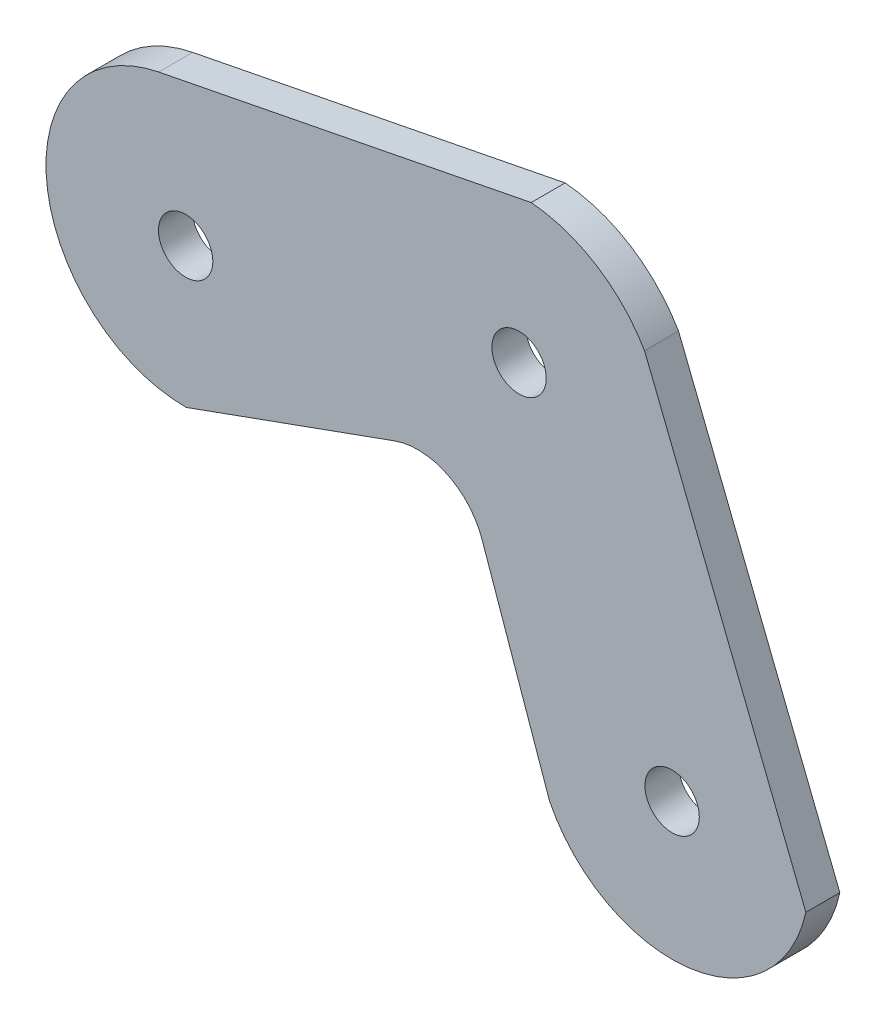
from build123d import *

# Parameters (mm, degrees)
SKETCH_1_R      = 4
EXTRUDE_1_DEPTH = 5


with BuildPart() as part:
    # 草图1 → 凸台-拉伸1 (new body)
    with BuildSketch(Plane.XY):
        with BuildLine():
            Line((36.178446258, 44.450768961), (66.852758603, 55.522112342))
            ThreePointArc((66.852758603, 55.522112342), (74.542251323, 55.146923882), (79.686411635, 49.419212353))
            Line((79.686411635, 49.419212353), (89.614398352, 21.050380059))
            ThreePointArc((89.614398352, 21.050380059), (110.127424639, 10.005834432), (127.344312529, 25.70121614))
            Line((127.344312529, 25.70121614), (103.609378398, 85.394704235))
            ThreePointArc((103.609378398, 85.394704235), (96.558072376, 92.705940943), (86.927534136, 95.93515633))
            Line((86.927534136, 95.93515633), (32.120142981, 85.163730465))
            ThreePointArc((32.120142981, 85.163730465), (15.634853586, 62.961714189), (36.178446258, 44.450768961))
        make_face()
        with Locations((36.082968492, 65)):
            Circle(SKETCH_1_R, mode=Mode.SUBTRACT)
        with Locations((107.662812973, 30)):
            Circle(SKETCH_1_R, mode=Mode.SUBTRACT)
        with Locations((85.144446225, 74.642167947)):
            Circle(SKETCH_1_R, mode=Mode.SUBTRACT)
    extrude(amount=EXTRUDE_1_DEPTH)


solid = part.part
